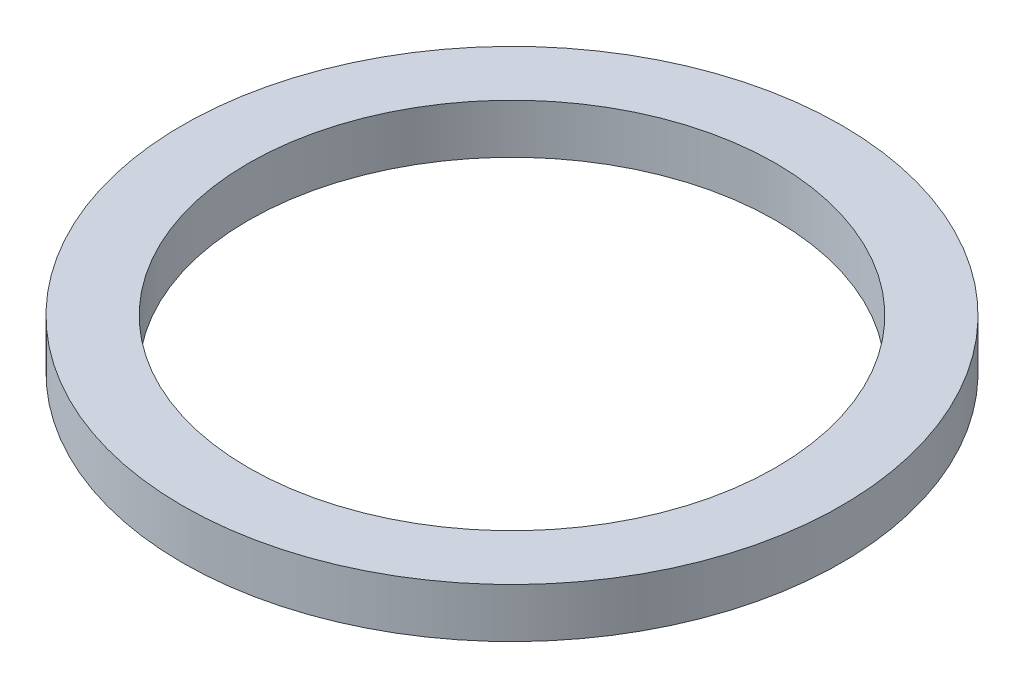
from build123d import *

# Parameters (mm, degrees)
ESQUISSE1_R        = 5
ESQUISSE1_R_2      = 4
BOSS_EXTRU_1_DEPTH = 0.75


with BuildPart() as part:
    # Esquisse1 → Boss.-Extru.1 (new body)
    with BuildSketch(Plane(origin=(0, 0, 0), x_dir=(1, 0, 0), z_dir=(0, 1, 0))):
        Circle(ESQUISSE1_R)
        Circle(ESQUISSE1_R_2, mode=Mode.SUBTRACT)
    extrude(amount=BOSS_EXTRU_1_DEPTH)


solid = part.part
